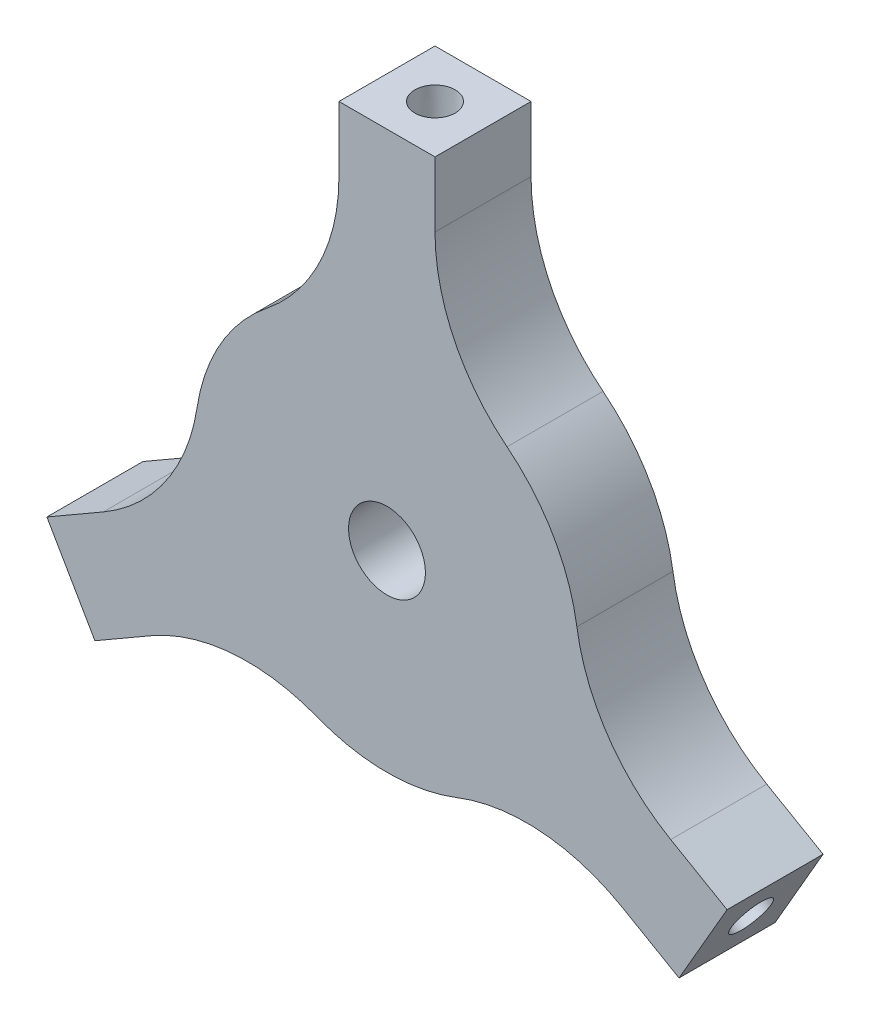
from build123d import *

# Parameters (mm, degrees)
BOSS_EXTRUDE1_DEPTH = 5
SKETCH2_R           = 1.05
CUT_EXTRUDE1_DEPTH  = 10
CIRPATTERN2_COUNT   = 3
DRAFT4_ANGLE        = 1
DRAFT5_ANGLE        = 1
DRAFT6_ANGLE        = 1
SKETCH3_R           = 2
CUT_EXTRUDE2_DEPTH  = 27.447092594
FILLET1_R           = 10


with BuildPart() as part:
    # Sketch1 → Boss-Extrude1 (new body)
    with BuildSketch(Plane.XY):
        with BuildLine():
            Line((7.135254916, -7.006292692), (15.204482672, -11.665063509))
            Line((15.204482672, -11.665063509), (17.704482672, -7.334936491))
            Line((17.704482672, -7.334936491), (9.635254916, -2.676165673))
            ThreePointArc((9.635254916, -2.676165673), (8.660254038, 5), (2.5, 9.682458366))
            Line((2.5, 9.682458366), (2.5, 19))
            Line((2.5, 19), (-2.5, 19))
            Line((-2.5, 19), (-2.5, 9.682458366))
            ThreePointArc((-2.5, 9.682458366), (-8.660254038, 5), (-9.635254916, -2.676165673))
            Line((-9.635254916, -2.676165673), (-17.704482672, -7.334936491))
            Line((-17.704482672, -7.334936491), (-15.204482672, -11.665063509))
            Line((-15.204482672, -11.665063509), (-7.135254916, -7.006292692))
            ThreePointArc((-7.135254916, -7.006292692), (0, -10), (7.135254916, -7.006292692))
        make_face()
    extrude(amount=BOSS_EXTRUDE1_DEPTH)

    # Sketch2 → Cut-Extrude1 (cut)
    with BuildSketch(Plane(origin=(0, 19, 0), x_dir=(1, 0, 0), z_dir=(0, 1, 0))):
        with Locations((0, -2.5)):
            Circle(SKETCH2_R)
    cut_extrude1 = extrude(amount=-CUT_EXTRUDE1_DEPTH, mode=Mode.SUBTRACT)

    # CirPattern2: Cut-Extrude1 ×3 about axis
    cirpattern2_axis = Axis((0, 0, 5), (0, 0, -1))
    for i in range(1, CIRPATTERN2_COUNT):
        add(cut_extrude1.rotate(cirpattern2_axis, i * 360 / CIRPATTERN2_COUNT), mode=Mode.SUBTRACT)

    # Draft4
    draft4_faces = [part.faces().sort_by_distance(p)[0] for p in [
        (-1.05, 14, 2.5),
    ]]
    draft(draft4_faces, Plane(origin=(-2.5, 19, 5), x_dir=(0, 0, 1), z_dir=(0, 1, 0)), DRAFT4_ANGLE)

    # Draft5
    draft5_faces = [part.faces().sort_by_distance(p)[0] for p in [
        (-11.599355653, -7.909326674, 2.5),
    ]]
    draft(draft5_faces, Plane(origin=(-17.704482672, -7.334936491, 5), x_dir=(0.4999999999999998, -0.8660254037844388, 0), z_dir=(-0.8660254037844388, -0.4999999999999998, 0)), DRAFT5_ANGLE)

    # Draft6
    draft6_faces = [part.faces().sort_by_distance(p)[0] for p in [
        (12.649355653, -6.090673326, 2.5),
    ]]
    draft(draft6_faces, Plane(origin=(15.204482672, -11.665063509, 5), x_dir=(0.4999999999999998, 0.8660254037844388, 0), z_dir=(0.8660254037844388, -0.4999999999999998, 0)), DRAFT6_ANGLE)

    # Sketch3 → Cut-Extrude2 (cut, through all)
    with BuildSketch(Plane(origin=(0, 0, 0), x_dir=(-1, 0, 0), z_dir=(0, 0, -1))):
        Circle(SKETCH3_R)
    extrude(amount=-CUT_EXTRUDE2_DEPTH, mode=Mode.SUBTRACT)

    # Fillet1
    fillet1_edges = [part.edges().sort_by_distance(p)[0] for p in [
        (2.5, 9.682458366, 2.5),
        (9.635254916, -2.676165673, 2.5),
        (7.135254916, -7.006292692, 2.5),
        (-7.135254916, -7.006292692, 2.5),
        (-9.635254916, -2.676165673, 2.5),
        (-2.5, 9.682458366, 2.5),
    ]]
    fillet(fillet1_edges, radius=FILLET1_R)


solid = part.part
